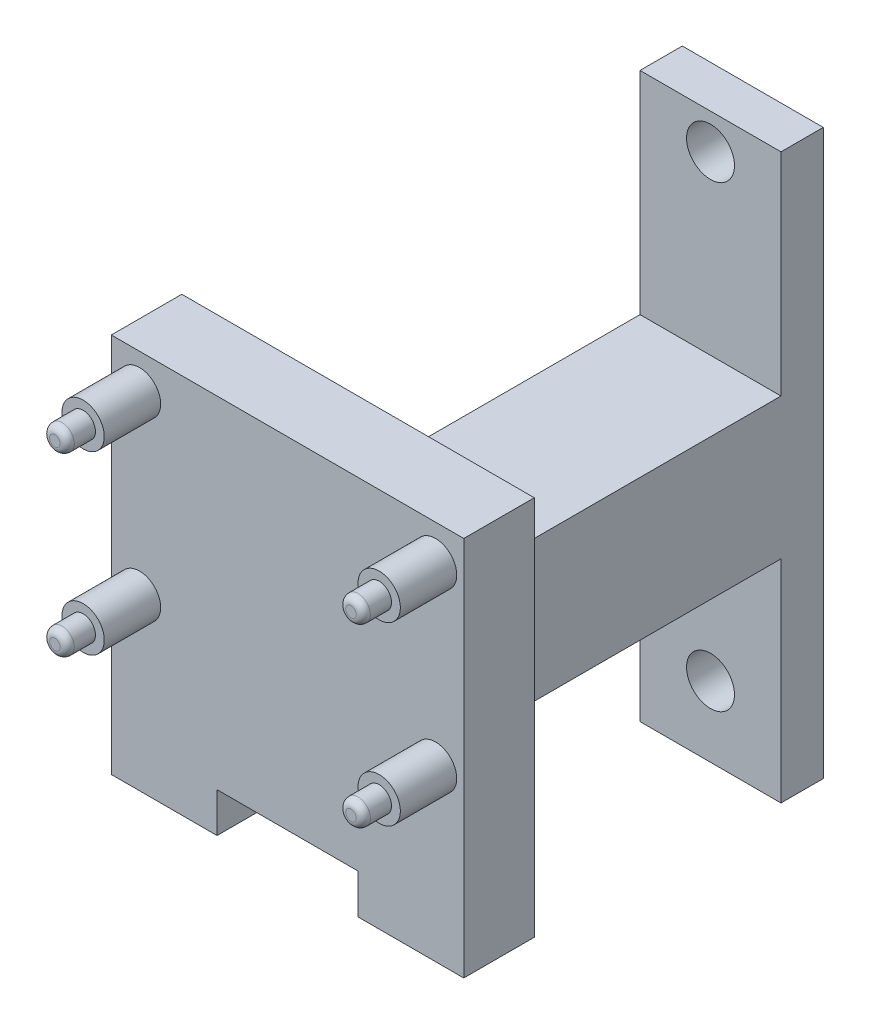
from build123d import *

# Parameters (mm, degrees)
SKETCH1_W           = 10
SKETCH1_H           = 40
BOSS_EXTRUDE1_DEPTH = 3
SKETCH2_R           = 1.7
CUT_EXTRUDE1_DEPTH  = 7
SKETCH3_W           = 10
SKETCH3_H           = 10
BOSS_EXTRUDE2_DEPTH = 25
SKETCH7_R           = 1
BOSS_EXTRUDE3_DEPTH = 5
SKETCH9_R           = 1.5
BOSS_EXTRUDE4_DEPTH = 9
SKETCH10_R          = 0.875
BOSS_EXTRUDE5_DEPTH = 2
FILLET1_R           = 0.5
CHAMFER1_SIZE       = 7.5
CHAMFER2_SIZE       = 7
SKETCH11_W          = 10
SKETCH11_H          = 2.819588602
CUT_EXTRUDE2_DEPTH  = 10


with BuildPart() as part:
    # Sketch1 → Boss-Extrude1 (new body)
    with BuildSketch(Plane.XY):
        with Locations((5, 20)):
            Rectangle(SKETCH1_W, SKETCH1_H)
    extrude(amount=BOSS_EXTRUDE1_DEPTH)

    # Sketch2 → Cut-Extrude1 (cut)
    with BuildSketch(Plane.XY.offset(3)):
        with Locations((5, 37.5)):
            Circle(SKETCH2_R)
        with Locations((5, 5)):
            Circle(SKETCH2_R)
    extrude(amount=-CUT_EXTRUDE1_DEPTH, mode=Mode.SUBTRACT)

    # Sketch3 → Boss-Extrude2 (add)
    with BuildSketch(Plane.XY.offset(3)):
        with Locations((5, 20)):
            Rectangle(SKETCH3_W, SKETCH3_H)
    extrude(amount=BOSS_EXTRUDE2_DEPTH)

    # Sketch7 → Boss-Extrude3 (add)
    with BuildSketch(Plane.XY.offset(28)):
        Polygon((-7.5, 8), (17.5, 8), (17.5, 32), (17.5, 35), (-7.5, 35), (-7.5, 32), align=None)
        with Locations((-5.5, 20)):
            Circle(SKETCH7_R, mode=Mode.SUBTRACT)
        with Locations((15.5, 20)):
            Circle(SKETCH7_R, mode=Mode.SUBTRACT)
        with Locations((-5.5, 32.5)):
            Circle(SKETCH7_R, mode=Mode.SUBTRACT)
        with Locations((15.5, 32.5)):
            Circle(SKETCH7_R, mode=Mode.SUBTRACT)
    extrude(amount=BOSS_EXTRUDE3_DEPTH)

    # Sketch9 → Boss-Extrude4 (add)
    with BuildSketch(Plane(origin=(0, 0, 28), x_dir=(-1, 0, 0), z_dir=(0, 0, -1))):
        with Locations((5.5, 32.5)):
            Circle(SKETCH9_R)
        with Locations((-15.5, 32.5)):
            Circle(SKETCH9_R)
        with Locations((-15.5, 20)):
            Circle(SKETCH9_R)
        with Locations((5.5, 20)):
            Circle(SKETCH9_R)
    extrude(amount=-BOSS_EXTRUDE4_DEPTH)

    # Sketch10 → Boss-Extrude5 (add)
    with BuildSketch(Plane.XY.offset(37)):
        with Locations((-5.5, 32.5)):
            Circle(SKETCH10_R)
        with Locations((15.5, 32.5)):
            Circle(SKETCH10_R)
        with Locations((15.5, 20)):
            Circle(SKETCH10_R)
        with Locations((-5.5, 20)):
            Circle(SKETCH10_R)
    extrude(amount=BOSS_EXTRUDE5_DEPTH)

    # Fillet1
    fillet1_edges = [part.edges().sort_by_distance(p)[0] for p in [
        (-6.375, 20, 39),
        (14.625, 20, 39),
        (14.625, 32.5, 39),
        (-6.375, 32.5, 39),
    ]]
    fillet(fillet1_edges, radius=FILLET1_R)

    # Chamfer1
    chamfer1_edges = [part.edges().sort_by_distance(p)[0] for p in [
        (0, 20, 28),
        (10, 20, 28),
    ]]
    chamfer(chamfer1_edges, length=CHAMFER1_SIZE - 0.0001)  # a hair under: the kernel refuses the full size

    # Chamfer2
    chamfer2_edges = [part.edges().sort_by_distance(p)[0] for p in [
        (5, 15, 28),
        (5, 25, 28),
    ]]
    chamfer(chamfer2_edges, length=CHAMFER2_SIZE - 0.0001)  # a hair under: the kernel refuses the full size

    # Sketch11 → Cut-Extrude2 (cut)
    with BuildSketch(Plane.XY.offset(33)):
        with Locations((5, 9.409794301)):
            Rectangle(SKETCH11_W, SKETCH11_H)
    extrude(amount=-CUT_EXTRUDE2_DEPTH, mode=Mode.SUBTRACT)


solid = part.part
